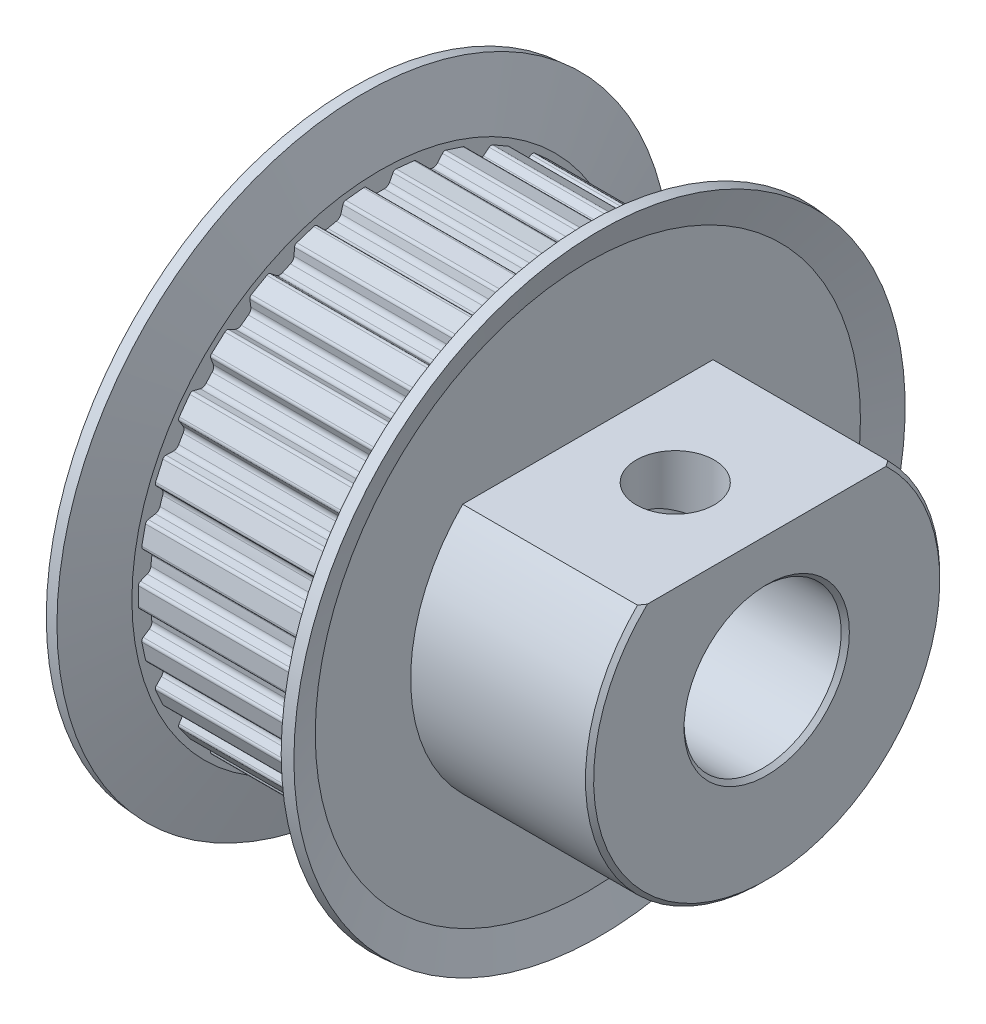
from build123d import *

# Parameters (mm, degrees)
SKETCH2_R           = 6.9342
BOSS_EXTRUDE1_DEPTH = 0.635
BOSS_EXTRUDE2_START = 7
SKETCH3_R           = 6.9342
BOSS_EXTRUDE2_DEPTH = 7
HOLE1_D             = 6.15
RIB1_REACH          = 21.087
SKETCH8_WALL_W      = 47.539641748
SKETCH8_WALL_H      = 0.868191958
RIB1_DRAFT_ANGLE    = 22
RIB2_REACH          = 21.087
SKETCH9_WALL_W      = 47.539641748
SKETCH9_WALL_H      = 0.868191958
RIB2_DRAFT_ANGLE    = 22
RIB3_REACH          = 21.087
SKETCH10_WALL_W     = 47.539641748
SKETCH10_WALL_H     = 0.868191958
RIB3_DRAFT_ANGLE    = 22
RIB4_REACH          = 21.087
SKETCH11_WALL_W     = 47.539641748
SKETCH11_WALL_H     = 0.868191958
RIB4_DRAFT_ANGLE    = 22
RIB5_REACH          = 21.087
SKETCH12_WALL_W     = 47.539641748
SKETCH12_WALL_H     = 0.868191958
RIB5_DRAFT_ANGLE    = 22
RIB6_REACH          = 21.087
SKETCH13_WALL_W     = 47.539641748
SKETCH13_WALL_H     = 0.868191958
RIB6_DRAFT_ANGLE    = 22
RIB7_REACH          = 21.087
SKETCH14_WALL_W     = 47.539641748
SKETCH14_WALL_H     = 0.868191958
RIB7_DRAFT_ANGLE    = 22
RIB8_REACH          = 21.087
SKETCH15_WALL_W     = 47.539641748
SKETCH15_WALL_H     = 0.868191958
RIB8_DRAFT_ANGLE    = 22
RIB9_REACH          = 21.087
SKETCH16_WALL_W     = 47.539641748
SKETCH16_WALL_H     = 0.868191958
RIB9_DRAFT_ANGLE    = 22
RIB10_REACH         = 21.087
SKETCH17_WALL_W     = 47.539641748
SKETCH17_WALL_H     = 0.868191958
RIB10_DRAFT_ANGLE   = 22
RIB11_REACH         = 21.087
SKETCH18_WALL_W     = 47.539641748
SKETCH18_WALL_H     = 0.868191958
RIB11_DRAFT_ANGLE   = 22
RIB12_REACH         = 21.087
SKETCH19_WALL_W     = 47.539641748
SKETCH19_WALL_H     = 0.868191958
RIB12_DRAFT_ANGLE   = 22
RIB13_REACH         = 21.087
SKETCH20_WALL_W     = 47.539641748
SKETCH20_WALL_H     = 0.868191958
RIB13_DRAFT_ANGLE   = 22
RIB14_REACH         = 21.087
SKETCH21_WALL_W     = 47.539641748
SKETCH21_WALL_H     = 0.868191958
RIB14_DRAFT_ANGLE   = 22
RIB15_REACH         = 21.087
SKETCH22_WALL_W     = 47.539641748
SKETCH22_WALL_H     = 0.868191958
RIB15_DRAFT_ANGLE   = 22
RIB16_REACH         = 21.087
SKETCH23_WALL_W     = 47.539641748
SKETCH23_WALL_H     = 0.868191958
RIB16_DRAFT_ANGLE   = 22
RIB17_REACH         = 21.087
SKETCH24_WALL_W     = 47.539641748
SKETCH24_WALL_H     = 0.868191958
RIB17_DRAFT_ANGLE   = 22
RIB18_REACH         = 21.087
SKETCH25_WALL_W     = 47.539641748
SKETCH25_WALL_H     = 0.868191958
RIB18_DRAFT_ANGLE   = 22
RIB19_REACH         = 21.087
SKETCH26_WALL_W     = 47.539641748
SKETCH26_WALL_H     = 0.868191958
RIB19_DRAFT_ANGLE   = 22
RIB20_REACH         = 21.087
SKETCH27_WALL_W     = 47.539641748
SKETCH27_WALL_H     = 0.868191958
RIB20_DRAFT_ANGLE   = 22
RIB21_REACH         = 21.087
SKETCH28_WALL_W     = 47.539641748
SKETCH28_WALL_H     = 0.868191958
RIB21_DRAFT_ANGLE   = 22
RIB22_REACH         = 21.087
SKETCH29_WALL_W     = 47.539641748
SKETCH29_WALL_H     = 0.868191958
RIB22_DRAFT_ANGLE   = 22
RIB23_REACH         = 21.087
SKETCH30_WALL_W     = 47.539641748
SKETCH30_WALL_H     = 0.868191958
RIB23_DRAFT_ANGLE   = 22
RIB24_REACH         = 21.087
SKETCH31_WALL_W     = 47.539641748
SKETCH31_WALL_H     = 0.868191958
RIB24_DRAFT_ANGLE   = 22
RIB25_REACH         = 21.087
SKETCH32_WALL_W     = 47.539641748
SKETCH32_WALL_H     = 0.868191958
RIB25_DRAFT_ANGLE   = 22
RIB26_REACH         = 21.087
SKETCH33_WALL_W     = 47.539641748
SKETCH33_WALL_H     = 0.868191958
RIB26_DRAFT_ANGLE   = 22
RIB27_REACH         = 21.087
SKETCH34_WALL_W     = 47.539641748
SKETCH34_WALL_H     = 0.868191958
RIB27_DRAFT_ANGLE   = 22
RIB28_REACH         = 21.087
SKETCH35_WALL_W     = 47.539641748
SKETCH35_WALL_H     = 0.868191958
RIB28_DRAFT_ANGLE   = 22
RIB29_REACH         = 21.087
SKETCH36_WALL_W     = 47.539641748
SKETCH36_WALL_H     = 0.868191958
RIB29_DRAFT_ANGLE   = 22
RIB30_REACH         = 21.087
SKETCH37_WALL_W     = 47.539641748
SKETCH37_WALL_H     = 0.868191958
RIB30_DRAFT_ANGLE   = 22
CHAMFER2_SIZE       = 0.16002
FILLET1_R           = 0.127
FILLET2_R           = 0.2286
SKETCH38_W          = 9.797351964
SKETCH38_H          = 2.36514239
CUT_EXTRUDE1_DEPTH  = 7
SKETCH39_R          = 1.525
CUT_EXTRUDE2_DEPTH  = 4.57


with BuildPart() as part:
    # Sketch1 → Revolve1 (revolve)
    with BuildSketch(Plane(origin=(0, 0, 0), x_dir=(-1, 0, 0), z_dir=(0, 0, -1))):
        Polygon((-0.67945, 10.668), (-0.67945, 0), (8.09625, 0), (8.09625, 10.668), (8.55345, 11.961500183), (8.09625, 12.0015), (7.46125, 9.7028), (7.46125, 8.9916), (0.09525, 8.9916), (0.09525, 9.7028), (-0.67945, 12.0015), (-1.13665, 11.961500183), align=None)
    revolve(axis=Axis((1.13665, 0, 0), (-1, 0, 0)))

    # Sketch2 → Boss-Extrude1 (add)
    with BuildSketch(Plane.ZY.offset(8.09625)):
        Circle(SKETCH2_R)
    extrude(amount=BOSS_EXTRUDE1_DEPTH)

    # Sketch3 → Boss-Extrude2 (add)
    with BuildSketch(Plane(origin=(0.67945, 0, 0), x_dir=(0, 0, -1), z_dir=(1, 0, 0)).offset(BOSS_EXTRUDE2_START)):
        Circle(SKETCH3_R)
    extrude(amount=-BOSS_EXTRUDE2_DEPTH)

    # Hole1 (through all)
    with Locations(Plane.ZY.offset(8.73125)):
        with Locations((0, 0)):
            Hole(HOLE1_D / 2)

    # Sketch8 wall → Rib1 (add, up to next)
    with BuildSketch(Plane(origin=(-3.77825, 0, 9.4488), x_dir=(1, 0, 0), z_dir=(0, 0, -1)), mode=Mode.PRIVATE) as rib1_sk1:
        Rectangle(SKETCH8_WALL_W, SKETCH8_WALL_H)
    rib1_tool1 = extrude(rib1_sk1.sketch, amount=RIB1_REACH, mode=Mode.PRIVATE) - part.part
    add(rib1_tool1.solids().sort_by_distance((-3.77825, 0, 9.4488))[0])

    # Rib1 draft
    rib1_draft_faces = [part.faces().sort_by_distance(p)[0] for p in [
        (-3.77825, -0.434095979, 9.231752011),
        (-3.77825, 0.434095979, 9.231752011),
    ]]
    draft(rib1_draft_faces, Plane(origin=(-3.77825, 0, 9.4488), x_dir=(1, 0, 0), z_dir=(0, 0, 1)), RIB1_DRAFT_ANGLE)

    # Sketch9 wall → Rib2 (add, up to next)
    with BuildSketch(Plane(origin=(-3.77825, 0, -9.4488), x_dir=(1, 0, 0), z_dir=(0, 0, 1)), mode=Mode.PRIVATE) as rib2_sk1:
        Rectangle(SKETCH9_WALL_W, SKETCH9_WALL_H)
    rib2_tool1 = extrude(rib2_sk1.sketch, amount=RIB2_REACH, mode=Mode.PRIVATE) - part.part
    add(rib2_tool1.solids().sort_by_distance((-3.77825, 0, -9.4488))[0])

    # Rib2 draft
    rib2_draft_faces = [part.faces().sort_by_distance(p)[0] for p in [
        (-3.77825, 0.434095979, -9.231752011),
        (-3.77825, -0.434095979, -9.231752011),
    ]]
    draft(rib2_draft_faces, Plane(origin=(-3.77825, 0, -9.4488), x_dir=(1, 0, 0), z_dir=(0, 0, -1)), RIB2_DRAFT_ANGLE)

    # Sketch10 wall → Rib3 (add, up to next)
    with BuildSketch(Plane(origin=(-3.77825, -9.397038485, 0.987668544), x_dir=(1, 0, 0), z_dir=(0, 0.994521895368, -0.104528463268)), mode=Mode.PRIVATE) as rib3_sk1:
        Rectangle(SKETCH10_WALL_W, SKETCH10_WALL_H)
    rib3_tool1 = extrude(rib3_sk1.sketch, amount=RIB3_REACH, mode=Mode.PRIVATE) - part.part
    add(rib3_tool1.solids().sort_by_distance((-3.77825, -9.397038485, 0.987668544))[0])

    # Rib3 draft
    rib3_draft_faces = [part.faces().sort_by_distance(p)[0] for p in [
        (-3.77825, -9.226554893, 0.533262895),
        (-3.77825, -9.135804122, 1.396698807),
    ]]
    draft(rib3_draft_faces, Plane(origin=(-3.77825, -9.397038485, 0.987668544), x_dir=(1, 0, 0), z_dir=(0, -0.994521895368, 0.104528463268)), RIB3_DRAFT_ANGLE)

    # Sketch11 wall → Rib4 (add, up to next)
    with BuildSketch(Plane(origin=(-3.77825, -8.182900835, -4.7244), x_dir=(1, 0, 0), z_dir=(0, 0.866025403784, 0.5)), mode=Mode.PRIVATE) as rib4_sk1:
        Rectangle(SKETCH11_WALL_W, SKETCH11_WALL_H)
    rib4_tool1 = extrude(rib4_sk1.sketch, amount=RIB4_REACH, mode=Mode.PRIVATE) - part.part
    add(rib4_tool1.solids().sort_by_distance((-3.77825, -8.182900835, -4.7244))[0])

    # Rib4 draft
    rib4_draft_faces = [part.faces().sort_by_distance(p)[0] for p in [
        (-3.77825, -7.777883773, -4.991814151),
        (-3.77825, -8.211979752, -4.23993786),
    ]]
    draft(rib4_draft_faces, Plane(origin=(-3.77825, -8.182900835, -4.7244), x_dir=(1, 0, 0), z_dir=(0, -0.866025403784, -0.5)), RIB4_DRAFT_ANGLE)

    # Sketch12 wall → Rib5 (add, up to next)
    with BuildSketch(Plane(origin=(-3.77825, 3.843173193, 8.63190832), x_dir=(1, 0, 0), z_dir=(0, -0.406736643076, -0.913545457643)), mode=Mode.PRIVATE) as rib5_sk1:
        Rectangle(SKETCH12_WALL_W, SKETCH12_WALL_H)
    rib5_tool1 = extrude(rib5_sk1.sketch, amount=RIB5_REACH, mode=Mode.PRIVATE) - part.part
    add(rib5_tool1.solids().sort_by_distance((-3.77825, 3.843173193, 8.63190832))[0])

    # Rib5 draft
    rib5_draft_faces = [part.faces().sort_by_distance(p)[0] for p in [
        (-3.77825, 3.358325413, 8.610187856),
        (-3.77825, 4.151458232, 8.257062374),
    ]]
    draft(rib5_draft_faces, Plane(origin=(-3.77825, 3.843173193, 8.63190832), x_dir=(1, 0, 0), z_dir=(0, 0.406736643076, 0.913545457643)), RIB5_DRAFT_ANGLE)

    # Sketch13 wall → Rib6 (add, up to next)
    with BuildSketch(Plane(origin=(-3.77825, -3.843173193, -8.63190832), x_dir=(1, 0, 0), z_dir=(0, 0.406736643076, 0.913545457643)), mode=Mode.PRIVATE) as rib6_sk1:
        Rectangle(SKETCH13_WALL_W, SKETCH13_WALL_H)
    rib6_tool1 = extrude(rib6_sk1.sketch, amount=RIB6_REACH, mode=Mode.PRIVATE) - part.part
    add(rib6_tool1.solids().sort_by_distance((-3.77825, -3.843173193, -8.63190832))[0])

    # Rib6 draft
    rib6_draft_faces = [part.faces().sort_by_distance(p)[0] for p in [
        (-3.77825, -3.358325413, -8.610187856),
        (-3.77825, -4.151458232, -8.257062374),
    ]]
    draft(rib6_draft_faces, Plane(origin=(-3.77825, -3.843173193, -8.63190832), x_dir=(1, 0, 0), z_dir=(0, -0.406736643076, -0.913545457643)), RIB6_DRAFT_ANGLE)

    # Sketch14 wall → Rib7 (add, up to next)
    with BuildSketch(Plane(origin=(-3.77825, -5.553865292, 7.644239776), x_dir=(1, 0, 0), z_dir=(0, 0.587785252292, -0.809016994375)), mode=Mode.PRIVATE) as rib7_sk1:
        Rectangle(SKETCH14_WALL_W, SKETCH14_WALL_H)
    rib7_tool1 = extrude(rib7_sk1.sketch, amount=RIB7_REACH, mode=Mode.PRIVATE) - part.part
    add(rib7_tool1.solids().sort_by_distance((-3.77825, -5.553865292, 7.644239776))[0])

    # Rib7 draft
    rib7_draft_faces = [part.faces().sort_by_distance(p)[0] for p in [
        (-3.77825, -5.777478709, 7.213489049),
        (-3.77825, -5.075096661, 7.723799478),
    ]]
    draft(rib7_draft_faces, Plane(origin=(-3.77825, -5.553865292, 7.644239776), x_dir=(1, 0, 0), z_dir=(0, -0.587785252292, 0.809016994375)), RIB7_DRAFT_ANGLE)

    # Sketch15 wall → Rib8 (add, up to next)
    with BuildSketch(Plane(origin=(-3.77825, 8.182900835, -4.7244), x_dir=(1, 0, 0), z_dir=(0, -0.866025403784, 0.5)), mode=Mode.PRIVATE) as rib8_sk1:
        Rectangle(SKETCH15_WALL_W, SKETCH15_WALL_H)
    rib8_tool1 = extrude(rib8_sk1.sketch, amount=RIB8_REACH, mode=Mode.PRIVATE) - part.part
    add(rib8_tool1.solids().sort_by_distance((-3.77825, 8.182900835, -4.7244))[0])

    # Rib8 draft
    rib8_draft_faces = [part.faces().sort_by_distance(p)[0] for p in [
        (-3.77825, 8.211979752, -4.23993786),
        (-3.77825, 7.777883773, -4.991814151),
    ]]
    draft(rib8_draft_faces, Plane(origin=(-3.77825, 8.182900835, -4.7244), x_dir=(1, 0, 0), z_dir=(0, 0.866025403784, -0.5)), RIB8_DRAFT_ANGLE)

    # Sketch16 wall → Rib9 (add, up to next)
    with BuildSketch(Plane(origin=(-3.77825, 8.182900835, 4.7244), x_dir=(1, 0, 0), z_dir=(0, -0.866025403784, -0.5)), mode=Mode.PRIVATE) as rib9_sk1:
        Rectangle(SKETCH16_WALL_W, SKETCH16_WALL_H)
    rib9_tool1 = extrude(rib9_sk1.sketch, amount=RIB9_REACH, mode=Mode.PRIVATE) - part.part
    add(rib9_tool1.solids().sort_by_distance((-3.77825, 8.182900835, 4.7244))[0])

    # Rib9 draft
    rib9_draft_faces = [part.faces().sort_by_distance(p)[0] for p in [
        (-3.77825, 7.777883773, 4.991814151),
        (-3.77825, 8.211979752, 4.23993786),
    ]]
    draft(rib9_draft_faces, Plane(origin=(-3.77825, 8.182900835, 4.7244), x_dir=(1, 0, 0), z_dir=(0, 0.866025403784, 0.5)), RIB9_DRAFT_ANGLE)

    # Sketch17 wall → Rib10 (add, up to next)
    with BuildSketch(Plane(origin=(-3.77825, 5.553865292, -7.644239776), x_dir=(1, 0, 0), z_dir=(0, -0.587785252292, 0.809016994375)), mode=Mode.PRIVATE) as rib10_sk1:
        Rectangle(SKETCH17_WALL_W, SKETCH17_WALL_H)
    rib10_tool1 = extrude(rib10_sk1.sketch, amount=RIB10_REACH, mode=Mode.PRIVATE) - part.part
    add(rib10_tool1.solids().sort_by_distance((-3.77825, 5.553865292, -7.644239776))[0])

    # Rib10 draft
    rib10_draft_faces = [part.faces().sort_by_distance(p)[0] for p in [
        (-3.77825, 5.777478709, -7.213489049),
        (-3.77825, 5.075096661, -7.723799478),
    ]]
    draft(rib10_draft_faces, Plane(origin=(-3.77825, 5.553865292, -7.644239776), x_dir=(1, 0, 0), z_dir=(0, 0.587785252292, -0.809016994375)), RIB10_DRAFT_ANGLE)

    # Sketch18 wall → Rib11 (add, up to next)
    with BuildSketch(Plane(origin=(-3.77825, 3.843173193, -8.63190832), x_dir=(1, 0, 0), z_dir=(0, -0.406736643076, 0.913545457643)), mode=Mode.PRIVATE) as rib11_sk1:
        Rectangle(SKETCH18_WALL_W, SKETCH18_WALL_H)
    rib11_tool1 = extrude(rib11_sk1.sketch, amount=RIB11_REACH, mode=Mode.PRIVATE) - part.part
    add(rib11_tool1.solids().sort_by_distance((-3.77825, 3.843173193, -8.63190832))[0])

    # Rib11 draft
    rib11_draft_faces = [part.faces().sort_by_distance(p)[0] for p in [
        (-3.77825, 4.151458232, -8.257062374),
        (-3.77825, 3.358325413, -8.610187856),
    ]]
    draft(rib11_draft_faces, Plane(origin=(-3.77825, 3.843173193, -8.63190832), x_dir=(1, 0, 0), z_dir=(0, 0.406736643076, -0.913545457643)), RIB11_DRAFT_ANGLE)

    # Sketch19 wall → Rib12 (add, up to next)
    with BuildSketch(Plane(origin=(-3.77825, 9.397038485, -0.987668544), x_dir=(1, 0, 0), z_dir=(0, -0.994521895368, 0.104528463268)), mode=Mode.PRIVATE) as rib12_sk1:
        Rectangle(SKETCH19_WALL_W, SKETCH19_WALL_H)
    rib12_tool1 = extrude(rib12_sk1.sketch, amount=RIB12_REACH, mode=Mode.PRIVATE) - part.part
    add(rib12_tool1.solids().sort_by_distance((-3.77825, 9.397038485, -0.987668544))[0])

    # Rib12 draft
    rib12_draft_faces = [part.faces().sort_by_distance(p)[0] for p in [
        (-3.77825, 9.226554893, -0.533262895),
        (-3.77825, 9.135804122, -1.396698807),
    ]]
    draft(rib12_draft_faces, Plane(origin=(-3.77825, 9.397038485, -0.987668544), x_dir=(1, 0, 0), z_dir=(0, 0.994521895368, -0.104528463268)), RIB12_DRAFT_ANGLE)

    # Sketch20 wall → Rib13 (add, up to next)
    with BuildSketch(Plane(origin=(-3.77825, -1.964515984, -9.24232105), x_dir=(1, 0, 0), z_dir=(0, 0.207911690818, 0.978147600734)), mode=Mode.PRIVATE) as rib13_sk1:
        Rectangle(SKETCH20_WALL_W, SKETCH20_WALL_H)
    rib13_tool1 = extrude(rib13_sk1.sketch, amount=RIB13_REACH, mode=Mode.PRIVATE) - part.part
    add(rib13_tool1.solids().sort_by_distance((-3.77825, -1.964515984, -9.24232105))[0])

    # Rib13 draft
    rib13_draft_faces = [part.faces().sort_by_distance(p)[0] for p in [
        (-3.77825, -1.494779229, -9.120269709),
        (-3.77825, -2.34399911, -8.939762451),
    ]]
    draft(rib13_draft_faces, Plane(origin=(-3.77825, -1.964515984, -9.24232105), x_dir=(1, 0, 0), z_dir=(0, -0.207911690818, -0.978147600734)), RIB13_DRAFT_ANGLE)

    # Sketch21 wall → Rib14 (add, up to next)
    with BuildSketch(Plane(origin=(-3.77825, -3.843173193, 8.63190832), x_dir=(1, 0, 0), z_dir=(0, 0.406736643076, -0.913545457643)), mode=Mode.PRIVATE) as rib14_sk1:
        Rectangle(SKETCH21_WALL_W, SKETCH21_WALL_H)
    rib14_tool1 = extrude(rib14_sk1.sketch, amount=RIB14_REACH, mode=Mode.PRIVATE) - part.part
    add(rib14_tool1.solids().sort_by_distance((-3.77825, -3.843173193, 8.63190832))[0])

    # Rib14 draft
    rib14_draft_faces = [part.faces().sort_by_distance(p)[0] for p in [
        (-3.77825, -4.151458232, 8.257062374),
        (-3.77825, -3.358325413, 8.610187856),
    ]]
    draft(rib14_draft_faces, Plane(origin=(-3.77825, -3.843173193, 8.63190832), x_dir=(1, 0, 0), z_dir=(0, -0.406736643076, 0.913545457643)), RIB14_DRAFT_ANGLE)

    # Sketch22 wall → Rib15 (add, up to next)
    with BuildSketch(Plane(origin=(-3.77825, 8.986342811, -2.919839776), x_dir=(1, 0, 0), z_dir=(0, -0.951056516295, 0.309016994375)), mode=Mode.PRIVATE) as rib15_sk1:
        Rectangle(SKETCH22_WALL_W, SKETCH22_WALL_H)
    rib15_tool1 = extrude(rib15_sk1.sketch, amount=RIB15_REACH, mode=Mode.PRIVATE) - part.part
    add(rib15_tool1.solids().sort_by_distance((-3.77825, 8.986342811, -2.919839776))[0])

    # Rib15 draft
    rib15_draft_faces = [part.faces().sort_by_distance(p)[0] for p in [
        (-3.77825, 8.914060941, -2.439918449),
        (-3.77825, 8.645774872, -3.265618068),
    ]]
    draft(rib15_draft_faces, Plane(origin=(-3.77825, 8.986342811, -2.919839776), x_dir=(1, 0, 0), z_dir=(0, 0.951056516295, -0.309016994375)), RIB15_DRAFT_ANGLE)

    # Sketch23 wall → Rib16 (add, up to next)
    with BuildSketch(Plane(origin=(-3.77825, -5.553865292, -7.644239776), x_dir=(1, 0, 0), z_dir=(0, 0.587785252292, 0.809016994375)), mode=Mode.PRIVATE) as rib16_sk1:
        Rectangle(SKETCH23_WALL_W, SKETCH23_WALL_H)
    rib16_tool1 = extrude(rib16_sk1.sketch, amount=RIB16_REACH, mode=Mode.PRIVATE) - part.part
    add(rib16_tool1.solids().sort_by_distance((-3.77825, -5.553865292, -7.644239776))[0])

    # Rib16 draft
    rib16_draft_faces = [part.faces().sort_by_distance(p)[0] for p in [
        (-3.77825, -5.075096661, -7.723799478),
        (-3.77825, -5.777478709, -7.213489049),
    ]]
    draft(rib16_draft_faces, Plane(origin=(-3.77825, -5.553865292, -7.644239776), x_dir=(1, 0, 0), z_dir=(0, -0.587785252292, -0.809016994375)), RIB16_DRAFT_ANGLE)

    # Sketch24 wall → Rib17 (add, up to next)
    with BuildSketch(Plane(origin=(-3.77825, -1.964515984, 9.24232105), x_dir=(1, 0, 0), z_dir=(0, 0.207911690818, -0.978147600734)), mode=Mode.PRIVATE) as rib17_sk1:
        Rectangle(SKETCH24_WALL_W, SKETCH24_WALL_H)
    rib17_tool1 = extrude(rib17_sk1.sketch, amount=RIB17_REACH, mode=Mode.PRIVATE) - part.part
    add(rib17_tool1.solids().sort_by_distance((-3.77825, -1.964515984, 9.24232105))[0])

    # Rib17 draft
    rib17_draft_faces = [part.faces().sort_by_distance(p)[0] for p in [
        (-3.77825, -2.34399911, 8.939762451),
        (-3.77825, -1.494779229, 9.120269709),
    ]]
    draft(rib17_draft_faces, Plane(origin=(-3.77825, -1.964515984, 9.24232105), x_dir=(1, 0, 0), z_dir=(0, -0.207911690818, 0.978147600734)), RIB17_DRAFT_ANGLE)

    # Sketch25 wall → Rib18 (add, up to next)
    with BuildSketch(Plane(origin=(-3.77825, 1.964515984, -9.24232105), x_dir=(1, 0, 0), z_dir=(0, -0.207911690818, 0.978147600734)), mode=Mode.PRIVATE) as rib18_sk1:
        Rectangle(SKETCH25_WALL_W, SKETCH25_WALL_H)
    rib18_tool1 = extrude(rib18_sk1.sketch, amount=RIB18_REACH, mode=Mode.PRIVATE) - part.part
    add(rib18_tool1.solids().sort_by_distance((-3.77825, 1.964515984, -9.24232105))[0])

    # Rib18 draft
    rib18_draft_faces = [part.faces().sort_by_distance(p)[0] for p in [
        (-3.77825, 2.34399911, -8.939762451),
        (-3.77825, 1.494779229, -9.120269709),
    ]]
    draft(rib18_draft_faces, Plane(origin=(-3.77825, 1.964515984, -9.24232105), x_dir=(1, 0, 0), z_dir=(0, 0.207911690818, -0.978147600734)), RIB18_DRAFT_ANGLE)

    # Sketch26 wall → Rib19 (add, up to next)
    with BuildSketch(Plane(origin=(-3.77825, -8.182900835, 4.7244), x_dir=(1, 0, 0), z_dir=(0, 0.866025403784, -0.5)), mode=Mode.PRIVATE) as rib19_sk1:
        Rectangle(SKETCH26_WALL_W, SKETCH26_WALL_H)
    rib19_tool1 = extrude(rib19_sk1.sketch, amount=RIB19_REACH, mode=Mode.PRIVATE) - part.part
    add(rib19_tool1.solids().sort_by_distance((-3.77825, -8.182900835, 4.7244))[0])

    # Rib19 draft
    rib19_draft_faces = [part.faces().sort_by_distance(p)[0] for p in [
        (-3.77825, -8.211979752, 4.23993786),
        (-3.77825, -7.777883773, 4.991814151),
    ]]
    draft(rib19_draft_faces, Plane(origin=(-3.77825, -8.182900835, 4.7244), x_dir=(1, 0, 0), z_dir=(0, -0.866025403784, 0.5)), RIB19_DRAFT_ANGLE)

    # Sketch27 wall → Rib20 (add, up to next)
    with BuildSketch(Plane(origin=(-3.77825, -7.021826827, -6.322481273), x_dir=(1, 0, 0), z_dir=(0, 0.743144825477, 0.669130606359)), mode=Mode.PRIVATE) as rib20_sk1:
        Rectangle(SKETCH27_WALL_W, SKETCH27_WALL_H)
    rib20_tool1 = extrude(rib20_sk1.sketch, amount=RIB20_REACH, mode=Mode.PRIVATE) - part.part
    add(rib20_tool1.solids().sort_by_distance((-3.77825, -7.021826827, -6.322481273))[0])

    # Rib20 draft
    rib20_draft_faces = [part.faces().sort_by_distance(p)[0] for p in [
        (-3.77825, -6.570061831, -6.499844001),
        (-3.77825, -7.150995642, -5.85465164),
    ]]
    draft(rib20_draft_faces, Plane(origin=(-3.77825, -7.021826827, -6.322481273), x_dir=(1, 0, 0), z_dir=(0, -0.743144825477, -0.669130606359)), RIB20_DRAFT_ANGLE)

    # Sketch28 wall → Rib21 (add, up to next)
    with BuildSketch(Plane(origin=(-3.77825, 1.964515984, 9.24232105), x_dir=(1, 0, 0), z_dir=(0, -0.207911690818, -0.978147600734)), mode=Mode.PRIVATE) as rib21_sk1:
        Rectangle(SKETCH28_WALL_W, SKETCH28_WALL_H)
    rib21_tool1 = extrude(rib21_sk1.sketch, amount=RIB21_REACH, mode=Mode.PRIVATE) - part.part
    add(rib21_tool1.solids().sort_by_distance((-3.77825, 1.964515984, 9.24232105))[0])

    # Rib21 draft
    rib21_draft_faces = [part.faces().sort_by_distance(p)[0] for p in [
        (-3.77825, 1.494779229, 9.120269709),
        (-3.77825, 2.34399911, 8.939762451),
    ]]
    draft(rib21_draft_faces, Plane(origin=(-3.77825, 1.964515984, 9.24232105), x_dir=(1, 0, 0), z_dir=(0, 0.207911690818, 0.978147600734)), RIB21_DRAFT_ANGLE)

    # Sketch29 wall → Rib22 (add, up to next)
    with BuildSketch(Plane(origin=(-3.77825, 7.021826827, 6.322481273), x_dir=(1, 0, 0), z_dir=(0, -0.743144825477, -0.669130606359)), mode=Mode.PRIVATE) as rib22_sk1:
        Rectangle(SKETCH29_WALL_W, SKETCH29_WALL_H)
    rib22_tool1 = extrude(rib22_sk1.sketch, amount=RIB22_REACH, mode=Mode.PRIVATE) - part.part
    add(rib22_tool1.solids().sort_by_distance((-3.77825, 7.021826827, 6.322481273))[0])

    # Rib22 draft
    rib22_draft_faces = [part.faces().sort_by_distance(p)[0] for p in [
        (-3.77825, 6.570061831, 6.499844001),
        (-3.77825, 7.150995642, 5.85465164),
    ]]
    draft(rib22_draft_faces, Plane(origin=(-3.77825, 7.021826827, 6.322481273), x_dir=(1, 0, 0), z_dir=(0, 0.743144825477, 0.669130606359)), RIB22_DRAFT_ANGLE)

    # Sketch30 wall → Rib23 (add, up to next)
    with BuildSketch(Plane(origin=(-3.77825, -7.021826827, 6.322481273), x_dir=(1, 0, 0), z_dir=(0, 0.743144825477, -0.669130606359)), mode=Mode.PRIVATE) as rib23_sk1:
        Rectangle(SKETCH30_WALL_W, SKETCH30_WALL_H)
    rib23_tool1 = extrude(rib23_sk1.sketch, amount=RIB23_REACH, mode=Mode.PRIVATE) - part.part
    add(rib23_tool1.solids().sort_by_distance((-3.77825, -7.021826827, 6.322481273))[0])

    # Rib23 draft
    rib23_draft_faces = [part.faces().sort_by_distance(p)[0] for p in [
        (-3.77825, -7.150995642, 5.85465164),
        (-3.77825, -6.570061831, 6.499844001),
    ]]
    draft(rib23_draft_faces, Plane(origin=(-3.77825, -7.021826827, 6.322481273), x_dir=(1, 0, 0), z_dir=(0, -0.743144825477, 0.669130606359)), RIB23_DRAFT_ANGLE)

    # Sketch31 wall → Rib24 (add, up to next)
    with BuildSketch(Plane(origin=(-3.77825, 7.021826827, -6.322481273), x_dir=(1, 0, 0), z_dir=(0, -0.743144825477, 0.669130606359)), mode=Mode.PRIVATE) as rib24_sk1:
        Rectangle(SKETCH31_WALL_W, SKETCH31_WALL_H)
    rib24_tool1 = extrude(rib24_sk1.sketch, amount=RIB24_REACH, mode=Mode.PRIVATE) - part.part
    add(rib24_tool1.solids().sort_by_distance((-3.77825, 7.021826827, -6.322481273))[0])

    # Rib24 draft
    rib24_draft_faces = [part.faces().sort_by_distance(p)[0] for p in [
        (-3.77825, 7.150995642, -5.85465164),
        (-3.77825, 6.570061831, -6.499844001),
    ]]
    draft(rib24_draft_faces, Plane(origin=(-3.77825, 7.021826827, -6.322481273), x_dir=(1, 0, 0), z_dir=(0, 0.743144825477, -0.669130606359)), RIB24_DRAFT_ANGLE)

    # Sketch32 wall → Rib25 (add, up to next)
    with BuildSketch(Plane(origin=(-3.77825, -8.986342811, -2.919839776), x_dir=(1, 0, 0), z_dir=(0, 0.951056516295, 0.309016994375)), mode=Mode.PRIVATE) as rib25_sk1:
        Rectangle(SKETCH32_WALL_W, SKETCH32_WALL_H)
    rib25_tool1 = extrude(rib25_sk1.sketch, amount=RIB25_REACH, mode=Mode.PRIVATE) - part.part
    add(rib25_tool1.solids().sort_by_distance((-3.77825, -8.986342811, -2.919839776))[0])

    # Rib25 draft
    rib25_draft_faces = [part.faces().sort_by_distance(p)[0] for p in [
        (-3.77825, -8.645774872, -3.265618068),
        (-3.77825, -8.914060941, -2.439918449),
    ]]
    draft(rib25_draft_faces, Plane(origin=(-3.77825, -8.986342811, -2.919839776), x_dir=(1, 0, 0), z_dir=(0, -0.951056516295, -0.309016994375)), RIB25_DRAFT_ANGLE)

    # Sketch33 wall → Rib26 (add, up to next)
    with BuildSketch(Plane(origin=(-3.77825, -8.986342811, 2.919839776), x_dir=(1, 0, 0), z_dir=(0, 0.951056516295, -0.309016994375)), mode=Mode.PRIVATE) as rib26_sk1:
        Rectangle(SKETCH33_WALL_W, SKETCH33_WALL_H)
    rib26_tool1 = extrude(rib26_sk1.sketch, amount=RIB26_REACH, mode=Mode.PRIVATE) - part.part
    add(rib26_tool1.solids().sort_by_distance((-3.77825, -8.986342811, 2.919839776))[0])

    # Rib26 draft
    rib26_draft_faces = [part.faces().sort_by_distance(p)[0] for p in [
        (-3.77825, -8.914060941, 2.439918449),
        (-3.77825, -8.645774872, 3.265618068),
    ]]
    draft(rib26_draft_faces, Plane(origin=(-3.77825, -8.986342811, 2.919839776), x_dir=(1, 0, 0), z_dir=(0, -0.951056516295, 0.309016994375)), RIB26_DRAFT_ANGLE)

    # Sketch34 wall → Rib27 (add, up to next)
    with BuildSketch(Plane(origin=(-3.77825, 8.986342811, 2.919839776), x_dir=(1, 0, 0), z_dir=(0, -0.951056516295, -0.309016994375)), mode=Mode.PRIVATE) as rib27_sk1:
        Rectangle(SKETCH34_WALL_W, SKETCH34_WALL_H)
    rib27_tool1 = extrude(rib27_sk1.sketch, amount=RIB27_REACH, mode=Mode.PRIVATE) - part.part
    add(rib27_tool1.solids().sort_by_distance((-3.77825, 8.986342811, 2.919839776))[0])

    # Rib27 draft
    rib27_draft_faces = [part.faces().sort_by_distance(p)[0] for p in [
        (-3.77825, 8.645774872, 3.265618068),
        (-3.77825, 8.914060941, 2.439918449),
    ]]
    draft(rib27_draft_faces, Plane(origin=(-3.77825, 8.986342811, 2.919839776), x_dir=(1, 0, 0), z_dir=(0, 0.951056516295, 0.309016994375)), RIB27_DRAFT_ANGLE)

    # Sketch35 wall → Rib28 (add, up to next)
    with BuildSketch(Plane(origin=(-3.77825, 5.553865292, 7.644239776), x_dir=(1, 0, 0), z_dir=(0, -0.587785252292, -0.809016994375)), mode=Mode.PRIVATE) as rib28_sk1:
        Rectangle(SKETCH35_WALL_W, SKETCH35_WALL_H)
    rib28_tool1 = extrude(rib28_sk1.sketch, amount=RIB28_REACH, mode=Mode.PRIVATE) - part.part
    add(rib28_tool1.solids().sort_by_distance((-3.77825, 5.553865292, 7.644239776))[0])

    # Rib28 draft
    rib28_draft_faces = [part.faces().sort_by_distance(p)[0] for p in [
        (-3.77825, 5.075096661, 7.723799478),
        (-3.77825, 5.777478709, 7.213489049),
    ]]
    draft(rib28_draft_faces, Plane(origin=(-3.77825, 5.553865292, 7.644239776), x_dir=(1, 0, 0), z_dir=(0, 0.587785252292, 0.809016994375)), RIB28_DRAFT_ANGLE)

    # Sketch36 wall → Rib29 (add, up to next)
    with BuildSketch(Plane(origin=(-3.77825, -9.397038485, -0.987668544), x_dir=(1, 0, 0), z_dir=(0, 0.994521895368, 0.104528463268)), mode=Mode.PRIVATE) as rib29_sk1:
        Rectangle(SKETCH36_WALL_W, SKETCH36_WALL_H)
    rib29_tool1 = extrude(rib29_sk1.sketch, amount=RIB29_REACH, mode=Mode.PRIVATE) - part.part
    add(rib29_tool1.solids().sort_by_distance((-3.77825, -9.397038485, -0.987668544))[0])

    # Rib29 draft
    rib29_draft_faces = [part.faces().sort_by_distance(p)[0] for p in [
        (-3.77825, -9.135804122, -1.396698807),
        (-3.77825, -9.226554893, -0.533262895),
    ]]
    draft(rib29_draft_faces, Plane(origin=(-3.77825, -9.397038485, -0.987668544), x_dir=(1, 0, 0), z_dir=(0, -0.994521895368, -0.104528463268)), RIB29_DRAFT_ANGLE)

    # Sketch37 wall → Rib30 (add, up to next)
    with BuildSketch(Plane(origin=(-3.77825, 9.397038485, 0.987668544), x_dir=(-1, 0, 0), z_dir=(0, -0.994521895368, -0.104528463268)), mode=Mode.PRIVATE) as rib30_sk1:
        Rectangle(SKETCH37_WALL_W, SKETCH37_WALL_H)
    rib30_tool1 = extrude(rib30_sk1.sketch, amount=RIB30_REACH, mode=Mode.PRIVATE) - part.part
    add(rib30_tool1.solids().sort_by_distance((-3.77825, 9.397038485, 0.987668544))[0])

    # Rib30 draft
    rib30_draft_faces = [part.faces().sort_by_distance(p)[0] for p in [
        (-3.77825, 9.226554893, 0.533262895),
        (-3.77825, 9.135804122, 1.396698807),
    ]]
    draft(rib30_draft_faces, Plane(origin=(-3.77825, 9.397038485, 0.987668544), x_dir=(-1, 0, 0), z_dir=(0, 0.994521895368, 0.104528463268)), RIB30_DRAFT_ANGLE)

    # Chamfer2
    chamfer2_edges = [part.edges().sort_by_distance(p)[0] for p in [
        (7.67945, 0, 3.075),
        (7.67945, 0, 6.9342),
        (-8.73125, 0, 3.075),
    ]]
    chamfer(chamfer2_edges, length=CHAMFER2_SIZE)

    # Fillet1
    fillet1_edges = [part.edges().sort_by_distance(p)[0] for p in [
        (-3.77825, 4.239739603, -8.455345579),
        (-3.77825, -8.852199776, -3.332689585),
        (-3.77825, -3.446606783, -8.808471061),
        (-3.77825, -2.389125924, 9.152067421),
        (-3.77825, 5.202674268, 7.89939499),
        (-3.77825, -0.434095979, 9.4488),
        (-3.77825, 0.434095979, -9.4488),
        (-3.77825, 0.434095979, 9.4488),
        (-3.77825, -6.731359921, -6.645077453),
        (-3.77825, 2.389125924, 9.152067421),
        (-3.77825, -9.442413871, 0.555950588),
        (-3.77825, 4.239739603, 8.455345579),
        (-3.77825, 5.905056316, -7.389084562),
        (-3.77825, 5.905056316, 7.389084562),
        (-3.77825, 2.389125924, -9.152067421),
        (-3.77825, 7.312293733, 5.999885093),
        (-3.77825, -1.539906044, -9.332574679),
        (-3.77825, 8.399948824, 4.348461855),
        (-3.77825, -5.202674268, -7.89939499),
        (-3.77825, 8.852199776, 3.332689585),
        (-3.77825, -7.965852846, -5.100338145),
        (-3.77825, 9.120485846, 2.506989967),
        (-3.77825, -9.351663099, -1.4193865),
        (-3.77825, 9.351663099, 1.4193865),
        (-3.77825, -9.120485846, 2.506989967),
        (-3.77825, 1.539906044, 9.332574679),
        (-3.77825, -4.239739603, 8.455345579),
        (-3.77825, -1.539906044, 9.332574679),
        (-3.77825, 5.202674268, -7.89939499),
        (-3.77825, -3.446606783, 8.808471061),
        (-3.77825, 3.446606783, -8.808471061),
        (-3.77825, -5.202674268, 7.89939499),
        (-3.77825, 1.539906044, -9.332574679),
        (-3.77825, -6.731359921, 6.645077453),
        (-3.77825, -0.434095979, -9.4488),
        (-3.77825, -7.965852846, 5.100338145),
        (-3.77825, -2.389125924, -9.152067421),
        (-3.77825, 9.442413871, 0.555950588),
        (-3.77825, -4.239739603, -8.455345579),
        (-3.77825, 9.442413871, -0.555950588),
        (-3.77825, -5.905056316, -7.389084562),
        (-3.77825, 7.965852846, 5.100338145),
        (-3.77825, -7.312293733, -5.999885093),
        (-3.77825, 6.731359921, 6.645077453),
        (-3.77825, -8.399948824, -4.348461855),
        (-3.77825, 9.351663099, -1.4193865),
        (-3.77825, -9.120485846, -2.506989967),
        (-3.77825, 9.120485846, -2.506989967),
        (-3.77825, -9.442413871, -0.555950588),
        (-3.77825, 8.852199776, -3.332689585),
        (-3.77825, -9.351663099, 1.4193865),
        (-3.77825, 8.399948824, -4.348461855),
        (-3.77825, -8.852199776, 3.332689585),
        (-3.77825, 7.965852846, -5.100338145),
        (-3.77825, 3.446606783, 8.808471061),
        (-3.77825, 7.312293733, -5.999885093),
        (-3.77825, 6.731359921, -6.645077453),
        (-3.77825, -7.312293733, 5.999885093),
        (-3.77825, -5.905056316, 7.389084562),
        (-3.77825, -8.399948824, 4.348461855),
    ]]
    fillet(fillet1_edges, radius=FILLET1_R)

    # Fillet2
    fillet2_edges = [part.edges().sort_by_distance(p)[0] for p in [
        (-3.77825, -8.724621819, -2.174820608),
        (-3.77825, -1.250935402, 8.904158084),
        (-3.77825, -7.454118169, 5.028418527),
        (-3.77825, -7.454118169, -5.028418527),
        (-3.77825, 5.780039841, 6.887670868),
        (-3.77825, -6.245760805, -6.468333829),
        (-3.77825, -8.854917866, 1.561825903),
        (-3.77825, -4.764433723, -7.625551905),
        (-3.77825, -4.764433723, 7.625551905),
        (-3.77825, -3.074878025, -8.449496772),
        (-3.77825, 2.478861014, 8.643154438),
        (-3.77825, -1.250935402, -8.904158084),
        (-3.77825, 8.08179727, 3.941246434),
        (-3.77825, 1.250935402, -8.904158084),
        (-3.77825, -8.986138529, -0.313344686),
        (-3.77825, 3.074878025, -8.449496772),
        (-3.77825, -8.336694801, 3.368737205),
        (-3.77825, 4.764433723, -7.625551905),
        (-3.77825, -6.245760805, 6.468333829),
        (-3.77825, 6.245760805, -6.468333829),
        (-3.77825, -3.074878025, 8.449496772),
        (-3.77825, 7.454118169, -5.028418527),
        (-3.77825, 0.627679101, 8.969664961),
        (-3.77825, 8.986138529, 0.313344686),
        (-3.77825, 4.221704807, 7.938896591),
        (-3.77825, 8.986138529, -0.313344686),
        (-3.77825, 7.085759399, 5.535420878),
        (-3.77825, 8.336694801, 3.368737205),
        (-3.77825, -8.336694801, -3.368737205),
        (-3.77825, 8.854917866, 1.561825903),
        (-3.77825, -8.854917866, -1.561825903),
        (-3.77825, 8.854917866, -1.561825903),
        (-3.77825, -8.986138529, 0.313344686),
        (-3.77825, 8.724621819, -2.174820608),
        (-3.77825, -8.724621819, 2.174820608),
        (-3.77825, 8.336694801, -3.368737205),
        (-3.77825, -8.08179727, 3.941246434),
        (-3.77825, 8.08179727, -3.941246434),
        (-3.77825, -7.085759399, 5.535420878),
        (-3.77825, 7.085759399, -5.535420878),
        (-3.77825, -5.780039841, 6.887670868),
        (-3.77825, 5.780039841, -6.887670868),
        (-3.77825, -4.221704807, 7.938896591),
        (-3.77825, 4.221704807, -7.938896591),
        (-3.77825, -2.478861014, 8.643154438),
        (-3.77825, 2.478861014, -8.643154438),
        (-3.77825, -0.627679101, 8.969664961),
        (-3.77825, 0.627679101, -8.969664961),
        (-3.77825, 1.250935402, 8.904158084),
        (-3.77825, -0.627679101, -8.969664961),
        (-3.77825, 3.074878025, 8.449496772),
        (-3.77825, -2.478861014, -8.643154438),
        (-3.77825, 4.764433723, 7.625551905),
        (-3.77825, -4.221704807, -7.938896591),
        (-3.77825, 6.245760805, 6.468333829),
        (-3.77825, -5.780039841, -6.887670868),
        (-3.77825, 7.454118169, 5.028418527),
        (-3.77825, -7.085759399, -5.535420878),
        (-3.77825, -8.08179727, -3.941246434),
        (-3.77825, 8.724621819, 2.174820608),
    ]]
    fillet(fillet2_edges, radius=FILLET2_R)

    # Sketch38 → Cut-Extrude1 (cut)
    with BuildSketch(Plane(origin=(7.67945, 0, 0), x_dir=(0, 0, -1), z_dir=(1, 0, 0))):
        with Locations((0, 6.09033069)):
            Rectangle(SKETCH38_W, SKETCH38_H)
    extrude(amount=-CUT_EXTRUDE1_DEPTH, mode=Mode.SUBTRACT)

    # Sketch39 → Cut-Extrude2 (cut)
    with BuildSketch(Plane(origin=(0, 4.907759495, 0), x_dir=(1, 0, 0), z_dir=(0, 1, 0))):
        with Locations((4.09944, 0)):
            Circle(SKETCH39_R)
    extrude(amount=-CUT_EXTRUDE2_DEPTH, mode=Mode.SUBTRACT)


solid = part.part
